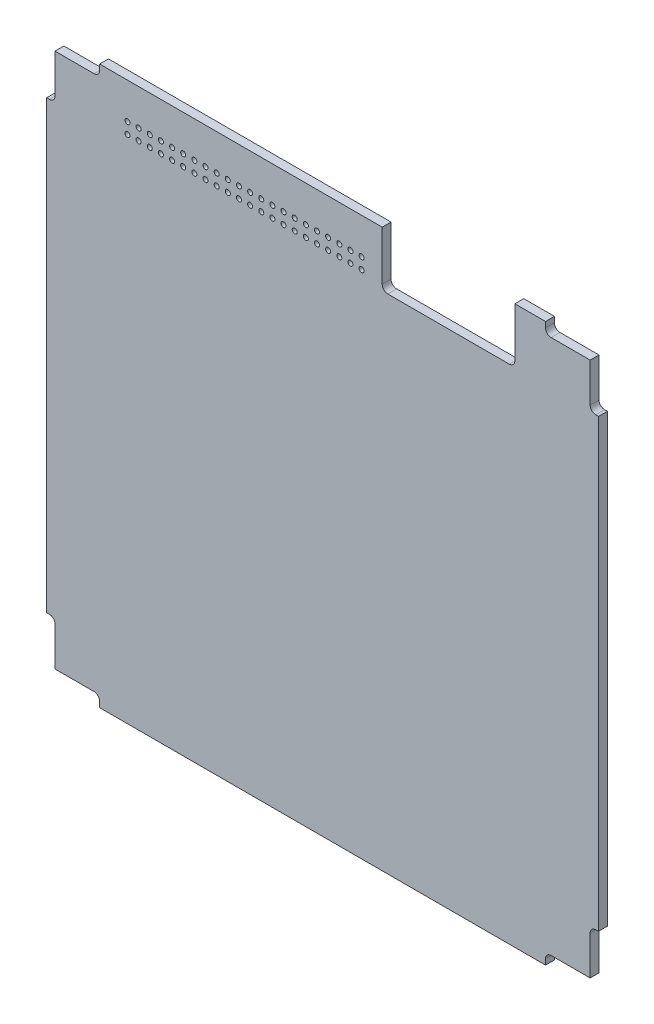
from build123d import *

# Parameters (mm, degrees)
BOSS_EXTRUDE1_DEPTH = 1.5875
FILLET1_R           = 1
SKETCH2_R           = 0.45
CUT_EXTRUDE1_DEPTH  = 71.728496069
CUT_EXTRUDE2_DEPTH  = 9.8806
FILLET2_R           = 1
SKETCH5_OUTSIDE_W   = 130.286
SKETCH5_OUTSIDE_H   = 130.286
SKETCH5_OUTSIDE_W_2 = 99
SKETCH5_OUTSIDE_H_2 = 100
CUT_EXTRUDE3_DEPTH  = 71.728496069


with BuildPart() as part:
    # Sketch1 → Boss-Extrude1 (new body)
    with BuildSketch(Plane.XY):
        Polygon((40, 50), (-40, 50), (-40, 48), (-48, 48), (-48, 40), (-50, 40), (-50, -37.864895224), (-50, -40), (-48, -40), (-48, -48), (-40, -48), (-40, -50), (-37.864895224, -50), (40, -50), (40, -48), (48, -48), (48, -40), (50, -40), (50, 40), (48, 40), (48, 48), (40, 48), align=None)
    extrude(amount=BOSS_EXTRUDE1_DEPTH)

    # Fillet1
    fillet1_edges = [part.edges().sort_by_distance(p)[0] for p in [
        (-48, -40, 0.79375),
        (-40, -48, 0.79375),
        (40, -48, 0.79375),
        (48, -40, 0.79375),
        (48, 40, 0.79375),
        (40, 48, 0.79375),
        (-40, 48, 0.79375),
        (-48, 40, 0.79375),
    ]]
    fillet(fillet1_edges, radius=FILLET1_R)

    # Sketch2 → Cut-Extrude1 (cut, through all)
    with BuildSketch(Plane.XY.offset(1.5875)):
        with Locations((-35, 43.55)):
            Circle(SKETCH2_R)
        with Locations((-33, 43.55)):
            Circle(SKETCH2_R)
        with Locations((-31, 43.55)):
            Circle(SKETCH2_R)
        with Locations((-29, 43.55)):
            Circle(SKETCH2_R)
        with Locations((-27, 43.55)):
            Circle(SKETCH2_R)
        with Locations((-25, 43.55)):
            Circle(SKETCH2_R)
        with Locations((-23, 43.55)):
            Circle(SKETCH2_R)
        with Locations((-21, 43.55)):
            Circle(SKETCH2_R)
        with Locations((-19, 43.55)):
            Circle(SKETCH2_R)
        with Locations((-17, 43.55)):
            Circle(SKETCH2_R)
        with Locations((-15, 43.55)):
            Circle(SKETCH2_R)
        with Locations((-13, 43.55)):
            Circle(SKETCH2_R)
        with Locations((-11, 43.55)):
            Circle(SKETCH2_R)
        with Locations((-9, 43.55)):
            Circle(SKETCH2_R)
        with Locations((-7, 43.55)):
            Circle(SKETCH2_R)
        with Locations((-5, 43.55)):
            Circle(SKETCH2_R)
        with Locations((-3, 43.55)):
            Circle(SKETCH2_R)
        with Locations((-1, 43.55)):
            Circle(SKETCH2_R)
        with Locations((1, 43.55)):
            Circle(SKETCH2_R)
        with Locations((3, 43.55)):
            Circle(SKETCH2_R)
        with Locations((5, 43.55)):
            Circle(SKETCH2_R)
        with Locations((7, 43.55)):
            Circle(SKETCH2_R)
        with Locations((-33, 41.55)):
            Circle(SKETCH2_R)
        with Locations((-31, 41.55)):
            Circle(SKETCH2_R)
        with Locations((-29, 41.55)):
            Circle(SKETCH2_R)
        with Locations((-27, 41.55)):
            Circle(SKETCH2_R)
        with Locations((-25, 41.55)):
            Circle(SKETCH2_R)
        with Locations((-23, 41.55)):
            Circle(SKETCH2_R)
        with Locations((-21, 41.55)):
            Circle(SKETCH2_R)
        with Locations((-19, 41.55)):
            Circle(SKETCH2_R)
        with Locations((-17, 41.55)):
            Circle(SKETCH2_R)
        with Locations((-15, 41.55)):
            Circle(SKETCH2_R)
        with Locations((-13, 41.55)):
            Circle(SKETCH2_R)
        with Locations((-11, 41.55)):
            Circle(SKETCH2_R)
        with Locations((-9, 41.55)):
            Circle(SKETCH2_R)
        with Locations((-7, 41.55)):
            Circle(SKETCH2_R)
        with Locations((-5, 41.55)):
            Circle(SKETCH2_R)
        with Locations((-3, 41.55)):
            Circle(SKETCH2_R)
        with Locations((-1, 41.55)):
            Circle(SKETCH2_R)
        with Locations((1, 41.55)):
            Circle(SKETCH2_R)
        with Locations((3, 41.55)):
            Circle(SKETCH2_R)
        with Locations((5, 41.55)):
            Circle(SKETCH2_R)
        with Locations((7, 41.55)):
            Circle(SKETCH2_R)
        with Locations((-35, 41.55)):
            Circle(SKETCH2_R)
    extrude(amount=-CUT_EXTRUDE1_DEPTH, mode=Mode.SUBTRACT)

    # Sketch3 → Cut-Extrude2 (cut)
    with BuildSketch(Plane(origin=(0, 50, 0), x_dir=(1, 0, 0), z_dir=(0, 1, 0))):
        Polygon((10.7, 0), (19.7, 0), (34.5, 0), (34.5, -1.5875), (19.7, -1.5875), (10.7, -1.5875), align=None)
    extrude(amount=-CUT_EXTRUDE2_DEPTH, mode=Mode.SUBTRACT)

    # Fillet2
    fillet2_edges = [part.edges().sort_by_distance(p)[0] for p in [
        (10.7, 40.1194, 0.79375),
        (34.5, 40.1194, 0.79375),
    ]]
    fillet(fillet2_edges, radius=FILLET2_R)

    # Sketch5 outside → Cut-Extrude3 (cut, through all)
    with BuildSketch(Plane(origin=(0, 0, 0), x_dir=(-1, 0, 0), z_dir=(0, 0, -1))):
        Rectangle(SKETCH5_OUTSIDE_W, SKETCH5_OUTSIDE_H)
        Rectangle(SKETCH5_OUTSIDE_W_2, SKETCH5_OUTSIDE_H_2, mode=Mode.SUBTRACT)
    extrude(amount=-CUT_EXTRUDE3_DEPTH, mode=Mode.SUBTRACT)


solid = part.part
